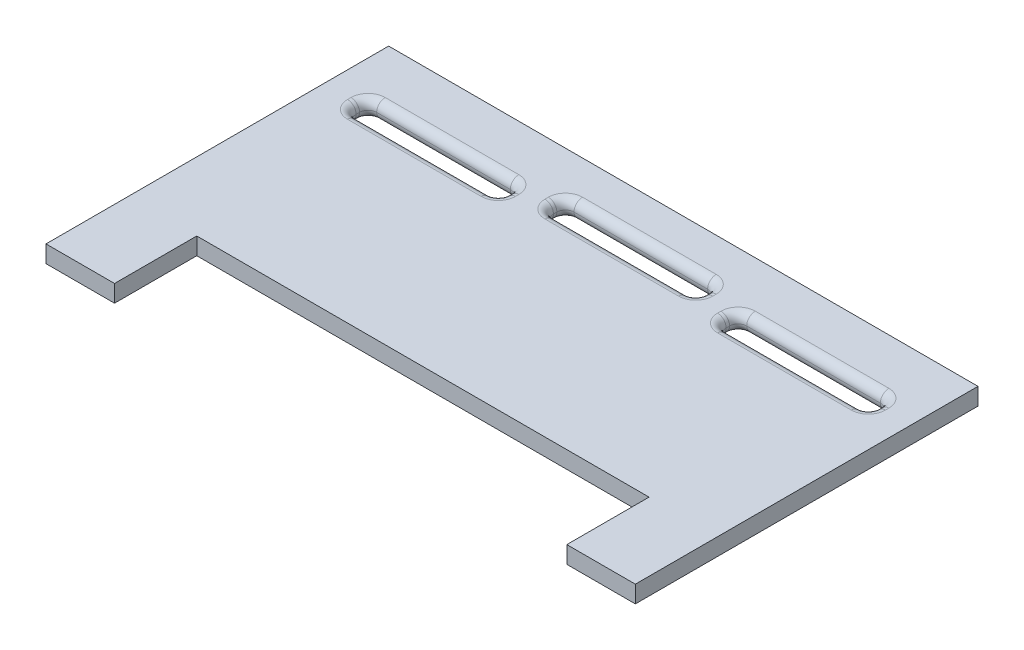
from build123d import *

# Parameters (mm, degrees)
SKETCH1_W           = 66
SKETCH1_H           = 38
BOSS_EXTRUDE1_DEPTH = 2.5
SKETCH3_W           = 50
SKETCH3_H           = 2.5
BOSS_EXTRUDE2_DEPTH = 10
SKETCH2_W           = 22
SKETCH2_H           = 3
CUT_EXTRUDE2_DEPTH  = 86.007352623
FILLET1_R           = 1.25


with BuildPart() as part:
    # Sketch1 → Boss-Extrude1 (new body)
    with BuildSketch(Plane(origin=(0, 0, 0), x_dir=(1, 0, 0), z_dir=(0, 1, 0))):
        with Locations((33, 19)):
            Rectangle(SKETCH1_W, SKETCH1_H)
    extrude(amount=BOSS_EXTRUDE1_DEPTH)

    # Sketch3 → Boss-Extrude2 (add)
    with BuildSketch(Plane.ZY):
        with Locations((-13, 1.25)):
            Rectangle(SKETCH3_W, SKETCH3_H)
    boss_extrude2 = extrude(amount=BOSS_EXTRUDE2_DEPTH)

    # Mirror1: Boss-Extrude2 across plane
    add(boss_extrude2.mirror(Plane(origin=(33, 0, 0), x_dir=(0, 0, 1), z_dir=(1, 0, 0))))

    # Sketch2 → Cut-Extrude2 (cut, through all)
    with BuildSketch(Plane.XZ):
        with Locations((33, -30.3)):
            Rectangle(SKETCH2_W, SKETCH2_H)
        with Locations((6, -28.5)):
            Rectangle(SKETCH2_W, SKETCH2_H)
        with Locations((60, -28.5)):
            Rectangle(SKETCH2_W, SKETCH2_H)
    extrude(amount=-CUT_EXTRUDE2_DEPTH, mode=Mode.SUBTRACT)

    # Fillet1
    fillet1_edges = [part.edges().sort_by_distance(p)[0] for p in [
        (71, 2.5, -28.5),
        (71, 1.25, -27),
        (60, 2.5, -30),
        (71, 1.25, -30),
        (49, 2.5, -28.5),
        (49, 1.25, -30),
        (60, 2.5, -27),
        (49, 1.25, -27),
        (71, 0, -28.5),
        (60, 0, -27),
        (49, 0, -28.5),
        (60, 0, -30),
        (-5, 2.5, -28.5),
        (-5, 1.25, -30),
        (6, 2.5, -27),
        (-5, 1.25, -27),
        (17, 2.5, -28.5),
        (17, 1.25, -27),
        (6, 2.5, -30),
        (17, 1.25, -30),
        (-5, 0, -28.5),
        (6, 0, -30),
        (17, 0, -28.5),
        (6, 0, -27),
        (22, 2.5, -30.3),
        (22, 1.25, -31.8),
        (33, 2.5, -28.8),
        (22, 1.25, -28.8),
        (44, 2.5, -30.3),
        (44, 1.25, -28.8),
        (33, 2.5, -31.8),
        (44, 1.25, -31.8),
        (22, 0, -30.3),
        (33, 0, -31.8),
        (44, 0, -30.3),
        (33, 0, -28.8),
    ]]
    fillet(fillet1_edges, radius=FILLET1_R - 0.0001)  # a hair under: the kernel refuses the full size


solid = part.part
